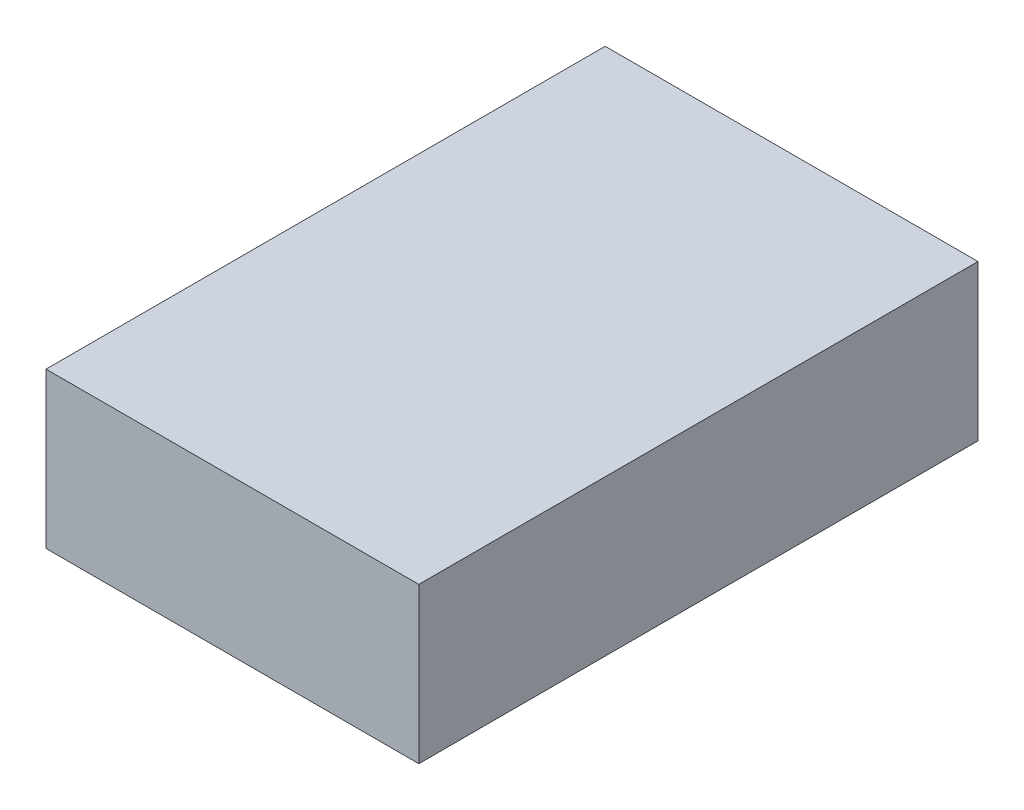
from build123d import *

# Parameters (mm, degrees)
SKETCH1_W           = 60
SKETCH1_H           = 90
BOSS_EXTRUDE1_DEPTH = 25


with BuildPart() as part:
    # Sketch1 → Boss-Extrude1 (new body)
    with BuildSketch(Plane(origin=(0, 0, 0), x_dir=(1, 0, 0), z_dir=(0, 1, 0))):
        Rectangle(SKETCH1_W, SKETCH1_H)
    extrude(amount=BOSS_EXTRUDE1_DEPTH)


solid = part.part
